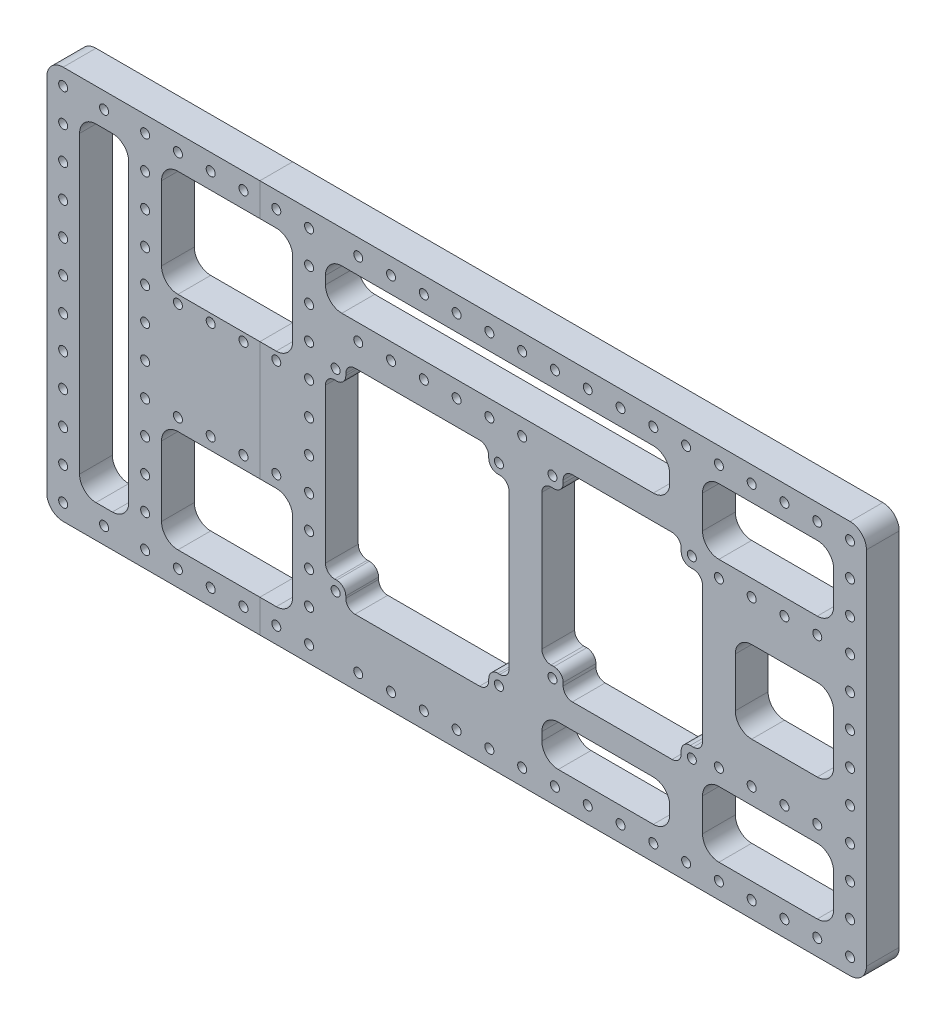
from build123d import *

# Parameters (mm, degrees)
CROQUIS1_W               = 250
CROQUIS1_H               = 120
SALIENTE_EXTRUIR1_DEPTH  = 10
CROQUIS2_W               = 15
CROQUIS2_H               = 100
CROQUIS2_W_2             = 40
CROQUIS2_W_3             = 56
CROQUIS2_H_2             = 12.5
CROQUIS2_H_3             = 65
CROQUIS2_W_4             = 50
CROQUIS2_H_4             = 70
CORTAR_EXTRUIR1_DEPTH    = 278.48873851
CROQUIS6_W               = 40
CROQUIS6_H               = 12.5
SALIENTE_EXTRUIR3_DEPTH  = 10
CROQUIS7_W               = 50
CROQUIS7_H               = 5
SALIENTE_EXTRUIR4_DEPTH  = 10
CROQUIS8_W               = 50
CROQUIS8_H               = 5
SALIENTE_EXTRUIR5_DEPTH  = 10
CROQUIS10_W              = 1
CROQUIS10_H              = 60
CROQUIS10_W_2            = 40
CROQUIS10_H_2            = 12.5
SALIENTE_EXTRUIR6_DEPTH  = 10
CROQUIS11_W              = 40
CROQUIS11_H              = 12.5
CORTAR_EXTRUIR3_DEPTH    = 278.48873851
CROQUIS12_W              = 40
CROQUIS12_H              = 12.5
SALIENTE_EXTRUIR7_DEPTH  = 10
CROQUIS13_W              = 40
CROQUIS13_H              = 25
SALIENTE_EXTRUIR9_DEPTH  = 10
CROQUIS14_W              = 30
CROQUIS14_H              = 60
CROQUIS14_W_2            = 39
CROQUIS14_H_2            = 12.5
CORTAR_EXTRUIR4_DEPTH    = 278.48873851
REDONDEO4_R              = 5
REDONDEO5_R              = 5
CROQUIS16_W              = 6.2
CROQUIS16_H              = 6.2
SALIENTE_EXTRUIR10_DEPTH = 10
CROQUIS17_W              = 6.5
CROQUIS17_H              = 6.5
SALIENTE_EXTRUIR12_DEPTH = 10
REDONDEO6_R              = 2.8
REDONDEO7_R              = 2.8
REDONDEO8_R              = 2.8
CROQUIS18_R              = 1.375
CORTAR_EXTRUIR5_DEPTH    = 278.48873851
CROQUIS19_W              = 30
CROQUIS19_H              = 17.5
SALIENTE_EXTRUIR13_DEPTH = 10
CROQUIS20_W              = 40
CROQUIS20_H              = 20
CORTAR_EXTRUIR7_DEPTH    = 278.48873851
REDONDEO9_R              = 5
CROQUIS21_R              = 1.375
CORTAR_EXTRUIR8_DEPTH    = 278.48873851
SALIENTE_EXTRUIR14_DEPTH = 10
CROQUIS23_W              = 40
CROQUIS23_H              = 25
CORTAR_EXTRUIR9_DEPTH    = 278.48873851
REDONDEO10_R             = 5
CROQUIS24_R              = 1.375
CORTAR_EXTRUIR10_DEPTH   = 278.48873851
CROQUIS25_R              = 1.375
CORTAR_EXTRUIR12_DEPTH   = 278.48873851
CROQUIS26_R              = 1.375
CORTAR_EXTRUIR13_DEPTH   = 278.48873851
CROQUIS29_R              = 1.375
CORTAR_EXTRUIR14_DEPTH   = 10
CROQUIS30_R              = 1.375
CORTAR_EXTRUIR15_DEPTH   = 278.48873851
CROQUIS35_W              = 187.46861443
CROQUIS35_H              = 5.495329455
CROQUIS35_W_2            = 76.300083138
CROQUIS35_H_2            = 6.008379166
SALIENTE_EXTRUIR18_DEPTH = 10
CROQUIS36_R              = 1.375
CORTAR_EXTRUIR16_DEPTH   = 278.48873851
CROQUIS37_W              = 100.140968042
CROQUIS37_H              = 4.413926966
SALIENTE_EXTRUIR19_DEPTH = 10
CROQUIS39_R              = 1.375
CORTAR_EXTRUIR17_DEPTH   = 10
CROQUIS40_R              = 1.375
CORTAR_EXTRUIR18_DEPTH   = 278.48873851
PARTIR1_SURFACE_1_BACK   = 278.489
PARTIR1_SURFACE_1_DEPTH  = 556.978
PARTIR1_SURFACE_2_BACK   = 278.489
PARTIR1_SURFACE_2_DEPTH  = 556.978


with BuildPart() as part:
    # Croquis1 → Saliente-Extruir1 (new body)
    with BuildSketch(Plane.XY):
        with Locations((125, 60)):
            Rectangle(CROQUIS1_W, CROQUIS1_H)
    extrude(amount=SALIENTE_EXTRUIR1_DEPTH)

    # Croquis2 → Cortar-Extruir1 (cut, through all)
    with BuildSketch(Plane.XY.offset(10)):
        with Locations((17.5, 60)):
            Rectangle(CROQUIS2_W, CROQUIS2_H)
        with Locations((55, 60)):
            Rectangle(CROQUIS2_W_2, CROQUIS2_H)
        with Locations((113, 103.75)):
            Rectangle(CROQUIS2_W_3, CROQUIS2_H_2)
        with Locations((113, 52.5)):
            Rectangle(CROQUIS2_W_3, CROQUIS2_H_3)
        with Locations((176, 60)):
            Rectangle(CROQUIS2_W_4, CROQUIS2_H_4)
    extrude(amount=-CORTAR_EXTRUIR1_DEPTH, mode=Mode.SUBTRACT)

    # Croquis6 → Saliente-Extruir3 (add)
    with BuildSketch(Plane.XY.offset(10)):
        with Locations((55, 91.25)):
            Rectangle(CROQUIS6_W, CROQUIS6_H)
    extrude(amount=-SALIENTE_EXTRUIR3_DEPTH)

    # Croquis7 → Saliente-Extruir4 (add)
    with BuildSketch(Plane.XY.offset(10)):
        with Locations((176, 27.5)):
            Rectangle(CROQUIS7_W, CROQUIS7_H)
    extrude(amount=-SALIENTE_EXTRUIR4_DEPTH)

    # Croquis8 → Saliente-Extruir5 (add)
    with BuildSketch(Plane.XY.offset(10)):
        with Locations((176, 92.5)):
            Rectangle(CROQUIS8_W, CROQUIS8_H)
    extrude(amount=-SALIENTE_EXTRUIR5_DEPTH)

    # Croquis10 → Saliente-Extruir6 (add)
    with BuildSketch(Plane.XY.offset(10)):
        with Locations((200.5, 60)):
            Rectangle(CROQUIS10_W, CROQUIS10_H)
        with Locations((220, 103.75)):
            Rectangle(CROQUIS10_W_2, CROQUIS10_H_2)
    extrude(amount=-SALIENTE_EXTRUIR6_DEPTH)

    # Croquis11 → Cortar-Extruir3 (cut, through all)
    with BuildSketch(Plane.XY.offset(10)):
        with Locations((220, 103.75)):
            Rectangle(CROQUIS11_W, CROQUIS11_H)
        with Locations((220, 16.25)):
            Rectangle(CROQUIS11_W, CROQUIS11_H)
    extrude(amount=-CORTAR_EXTRUIR3_DEPTH, mode=Mode.SUBTRACT)

    # Croquis12 → Saliente-Extruir7 (add)
    with BuildSketch(Plane.XY.offset(10)):
        with Locations((55, 78.75)):
            Rectangle(CROQUIS12_W, CROQUIS12_H)
    extrude(amount=-SALIENTE_EXTRUIR7_DEPTH)

    # Croquis13 → Saliente-Extruir9 (add)
    with BuildSketch(Plane.XY.offset(10)):
        with Locations((55, 35)):
            Rectangle(CROQUIS13_W, CROQUIS13_H)
    extrude(amount=-SALIENTE_EXTRUIR9_DEPTH)

    # Croquis14 → Cortar-Extruir4 (cut, through all)
    with BuildSketch(Plane.XY.offset(10)):
        Polygon((151, 110), (141, 110), (141, 97.5), (151, 97.5), (190, 97.5), (190, 110), align=None)
        with Locations((225, 60)):
            Rectangle(CROQUIS14_W, CROQUIS14_H)
        with Locations((170.5, 16.25)):
            Rectangle(CROQUIS14_W_2, CROQUIS14_H_2)
    extrude(amount=-CORTAR_EXTRUIR4_DEPTH, mode=Mode.SUBTRACT)

    # Redondeo4
    redondeo4_edges = [part.edges().sort_by_distance(p)[0] for p in [
        (10, 110, 5),
        (35, 72.5, 5),
        (85, 97.5, 5),
        (35, 110, 5),
        (85, 110, 5),
        (200, 22.5, 5),
        (210, 90, 5),
        (200, 110, 5),
        (210, 30, 5),
        (240, 30, 5),
        (240, 10, 5),
        (240, 97.5, 5),
        (190, 10, 5),
        (190, 97.5, 5),
        (25, 10, 5),
        (75, 97.5, 5),
        (75, 47.5, 5),
        (75, 10, 5),
        (10, 10, 5),
        (35, 97.5, 5),
        (35, 47.5, 5),
        (35, 10, 5),
        (151, 10, 5),
        (200, 10, 5),
        (200, 97.5, 5),
        (190, 22.5, 5),
        (240, 22.5, 5),
        (240, 90, 5),
        (240, 110, 5),
        (190, 110, 5),
        (75, 22.5, 5),
        (75, 72.5, 5),
        (75, 110, 5),
        (25, 110, 5),
        (0, 120, 5),
        (0, 0, 5),
        (250, 0, 5),
        (250, 120, 5),
    ]]
    fillet(redondeo4_edges, radius=REDONDEO4_R)

    # Redondeo5
    redondeo5_edges = [part.edges().sort_by_distance(p)[0] for p in [
        (35, 22.5, 5),
        (151, 22.5, 5),
    ]]
    fillet(redondeo5_edges, radius=REDONDEO5_R)

    # Croquis16 → Saliente-Extruir10 (add)
    with BuildSketch(Plane.XY.offset(10)):
        with Locations((88.1, 23.1)):
            Rectangle(CROQUIS16_W, CROQUIS16_H)
        with Locations((137.9, 23.1)):
            Rectangle(CROQUIS16_W, CROQUIS16_H)
        with Locations((137.9, 81.9)):
            Rectangle(CROQUIS16_W, CROQUIS16_H)
        with Locations((88.1, 81.9)):
            Rectangle(CROQUIS16_W, CROQUIS16_H)
    extrude(amount=-SALIENTE_EXTRUIR10_DEPTH)

    # Croquis17 → Saliente-Extruir12 (add)
    with BuildSketch(Plane.XY.offset(10)):
        with Locations((154.25, 86.75)):
            Rectangle(CROQUIS17_W, CROQUIS17_H)
        with Locations((154.25, 33.25)):
            Rectangle(CROQUIS17_W, CROQUIS17_H)
        with Locations((196.75, 86.75)):
            Rectangle(CROQUIS17_W, CROQUIS17_H)
        with Locations((196.75, 33.25)):
            Rectangle(CROQUIS17_W, CROQUIS17_H)
    extrude(amount=-SALIENTE_EXTRUIR12_DEPTH)

    # Redondeo6
    redondeo6_edges = [part.edges().sort_by_distance(p)[0] for p in [
        (157.5, 83.5, 5),
        (157.5, 36.5, 5),
        (193.5, 36.5, 5),
        (193.5, 83.5, 5),
        (134.8, 26.2, 5),
        (134.8, 78.8, 5),
        (91.2, 26.2, 5),
        (91.2, 78.8, 5),
    ]]
    fillet(redondeo6_edges, radius=REDONDEO6_R)

    # Redondeo7
    redondeo7_edges = [part.edges().sort_by_distance(p)[0] for p in [
        (193.5, 30, 5),
        (200, 36.5, 5),
        (200, 83.5, 5),
        (193.5, 90, 5),
        (134.8, 85, 5),
        (141, 78.8, 5),
        (141, 26.2, 5),
        (134.8, 20, 5),
        (157.5, 30, 5),
        (151, 36.5, 5),
        (91.2, 20, 5),
        (85, 26.2, 5),
        (85, 78.8, 5),
        (91.2, 85, 5),
    ]]
    fillet(redondeo7_edges, radius=REDONDEO7_R)

    # Redondeo8
    redondeo8_edges = [part.edges().sort_by_distance(p)[0] for p in [
        (151, 83.5, 5),
        (157.5, 90, 5),
    ]]
    fillet(redondeo8_edges, radius=REDONDEO8_R)

    # Croquis18 → Cortar-Extruir5 (cut, through all)
    with BuildSketch(Plane.XY.offset(10)):
        with Locations((137.9, 23.1)):
            Circle(CROQUIS18_R)
        with Locations((88.1, 23.1)):
            Circle(CROQUIS18_R)
        with Locations((88.1, 81.9)):
            Circle(CROQUIS18_R)
        with Locations((137.9, 81.9)):
            Circle(CROQUIS18_R)
        with Locations((154.25, 33.25)):
            Circle(CROQUIS18_R)
        with Locations((196.75, 33.25)):
            Circle(CROQUIS18_R)
        with Locations((196.75, 86.75)):
            Circle(CROQUIS18_R)
        with Locations((154.25, 86.75)):
            Circle(CROQUIS18_R)
    extrude(amount=-CORTAR_EXTRUIR5_DEPTH, mode=Mode.SUBTRACT)

    # Croquis19 → Saliente-Extruir13 (add)
    with BuildSketch(Plane.XY.offset(10)):
        with Locations((225, 81.25)):
            Rectangle(CROQUIS19_W, CROQUIS19_H)
        with Locations((225, 38.75)):
            Rectangle(CROQUIS19_W, CROQUIS19_H)
    extrude(amount=-SALIENTE_EXTRUIR13_DEPTH)

    # Croquis20 → Cortar-Extruir7 (cut, through all)
    with BuildSketch(Plane.XY.offset(10)):
        with Locations((220, 20)):
            Rectangle(CROQUIS20_W, CROQUIS20_H)
        with Locations((220, 100)):
            Rectangle(CROQUIS20_W, CROQUIS20_H)
    extrude(amount=-CORTAR_EXTRUIR7_DEPTH, mode=Mode.SUBTRACT)

    # Redondeo9
    redondeo9_edges = [part.edges().sort_by_distance(p)[0] for p in [
        (200, 10, 5),
        (210, 47.5, 5),
        (200, 90, 5),
        (240, 10, 5),
        (240, 47.5, 5),
        (240, 90, 5),
        (240, 30, 5),
        (240, 72.5, 5),
        (240, 110, 5),
        (200, 30, 5),
        (200, 110, 5),
        (210, 72.5, 5),
    ]]
    fillet(redondeo9_edges, radius=REDONDEO9_R)

    # Croquis21 → Cortar-Extruir8 (cut, through all)
    with BuildSketch(Plane.XY.offset(10)):
        with Locations((5, 115)):
            Circle(CROQUIS21_R)
        with Locations((5, 105)):
            Circle(CROQUIS21_R)
        with Locations((5, 95)):
            Circle(CROQUIS21_R)
        with Locations((5, 85)):
            Circle(CROQUIS21_R)
        with Locations((5, 75)):
            Circle(CROQUIS21_R)
        with Locations((5, 65)):
            Circle(CROQUIS21_R)
        with Locations((5, 55)):
            Circle(CROQUIS21_R)
        with Locations((5, 45)):
            Circle(CROQUIS21_R)
        with Locations((5, 35)):
            Circle(CROQUIS21_R)
        with Locations((5, 25)):
            Circle(CROQUIS21_R)
        with Locations((5, 15)):
            Circle(CROQUIS21_R)
        with Locations((5, 5)):
            Circle(CROQUIS21_R)
        with Locations((245, 5)):
            Circle(CROQUIS21_R)
        with Locations((245, 15)):
            Circle(CROQUIS21_R)
        with Locations((245, 25)):
            Circle(CROQUIS21_R)
        with Locations((245, 35)):
            Circle(CROQUIS21_R)
        with Locations((245, 45)):
            Circle(CROQUIS21_R)
        with Locations((245, 55)):
            Circle(CROQUIS21_R)
        with Locations((245, 65)):
            Circle(CROQUIS21_R)
        with Locations((245, 75)):
            Circle(CROQUIS21_R)
        with Locations((245, 85)):
            Circle(CROQUIS21_R)
        with Locations((245, 95)):
            Circle(CROQUIS21_R)
        with Locations((245, 105)):
            Circle(CROQUIS21_R)
        with Locations((245, 115)):
            Circle(CROQUIS21_R)
        with Locations((15, 115)):
            Circle(CROQUIS21_R)
        with Locations((25, 115)):
            Circle(CROQUIS21_R)
        with Locations((35, 115)):
            Circle(CROQUIS21_R)
        with Locations((45, 115)):
            Circle(CROQUIS21_R)
        with Locations((55, 115)):
            Circle(CROQUIS21_R)
        with Locations((65, 115)):
            Circle(CROQUIS21_R)
        with Locations((75, 115)):
            Circle(CROQUIS21_R)
        with Locations((85, 115)):
            Circle(CROQUIS21_R)
        with Locations((95, 115)):
            Circle(CROQUIS21_R)
        with Locations((105, 115)):
            Circle(CROQUIS21_R)
        with Locations((115, 115)):
            Circle(CROQUIS21_R)
        with Locations((125, 115)):
            Circle(CROQUIS21_R)
        with Locations((135, 115)):
            Circle(CROQUIS21_R)
        with Locations((145, 115)):
            Circle(CROQUIS21_R)
        with Locations((155, 115)):
            Circle(CROQUIS21_R)
        with Locations((165, 115)):
            Circle(CROQUIS21_R)
        with Locations((175, 115)):
            Circle(CROQUIS21_R)
        with Locations((185, 115)):
            Circle(CROQUIS21_R)
        with Locations((195, 115)):
            Circle(CROQUIS21_R)
        with Locations((205, 115)):
            Circle(CROQUIS21_R)
        with Locations((215, 115)):
            Circle(CROQUIS21_R)
        with Locations((225, 115)):
            Circle(CROQUIS21_R)
        with Locations((235, 115)):
            Circle(CROQUIS21_R)
        with Locations((235, 5)):
            Circle(CROQUIS21_R)
        with Locations((225, 5)):
            Circle(CROQUIS21_R)
        with Locations((215, 5)):
            Circle(CROQUIS21_R)
        with Locations((205, 5)):
            Circle(CROQUIS21_R)
        with Locations((195, 5)):
            Circle(CROQUIS21_R)
        with Locations((185, 5)):
            Circle(CROQUIS21_R)
        with Locations((175, 5)):
            Circle(CROQUIS21_R)
        with Locations((165, 5)):
            Circle(CROQUIS21_R)
        with Locations((155, 5)):
            Circle(CROQUIS21_R)
        with Locations((145, 5)):
            Circle(CROQUIS21_R)
        with Locations((135, 5)):
            Circle(CROQUIS21_R)
        with Locations((125, 5)):
            Circle(CROQUIS21_R)
        with Locations((115, 5)):
            Circle(CROQUIS21_R)
        with Locations((105, 5)):
            Circle(CROQUIS21_R)
        with Locations((95, 5)):
            Circle(CROQUIS21_R)
        with Locations((85, 5)):
            Circle(CROQUIS21_R)
        with Locations((75, 5)):
            Circle(CROQUIS21_R)
        with Locations((65, 5)):
            Circle(CROQUIS21_R)
        with Locations((55, 5)):
            Circle(CROQUIS21_R)
        with Locations((45, 5)):
            Circle(CROQUIS21_R)
        with Locations((35, 5)):
            Circle(CROQUIS21_R)
        with Locations((25, 5)):
            Circle(CROQUIS21_R)
        with Locations((15, 5)):
            Circle(CROQUIS21_R)
    extrude(amount=-CORTAR_EXTRUIR8_DEPTH, mode=Mode.SUBTRACT)

    # Croquis22 → Saliente-Extruir14 (add)
    with BuildSketch(Plane.XY.offset(10)):
        Polygon((35, 16.25), (75, 16.25), (75, 38.248408684), (75, 102.5), (35, 102.5), align=None)
    extrude(amount=-SALIENTE_EXTRUIR14_DEPTH)

    # Croquis23 → Cortar-Extruir9 (cut, through all)
    with BuildSketch(Plane.XY.offset(10)):
        with Locations((55, 28.75)):
            Rectangle(CROQUIS23_W, CROQUIS23_H)
        with Locations((55, 90)):
            Rectangle(CROQUIS23_W, CROQUIS23_H)
    extrude(amount=-CORTAR_EXTRUIR9_DEPTH, mode=Mode.SUBTRACT)

    # Redondeo10
    redondeo10_edges = [part.edges().sort_by_distance(p)[0] for p in [
        (35, 77.5, 5),
        (75, 77.5, 5),
        (75, 41.25, 5),
        (35, 41.25, 5),
    ]]
    fillet(redondeo10_edges, radius=REDONDEO10_R)

    # Croquis24 → Cortar-Extruir10 (cut, through all)
    with BuildSketch(Plane.XY.offset(10)):
        with Locations((30, 105)):
            Circle(CROQUIS24_R)
        with Locations((30, 95)):
            Circle(CROQUIS24_R)
        with Locations((30, 85)):
            Circle(CROQUIS24_R)
        with Locations((30, 75)):
            Circle(CROQUIS24_R)
        with Locations((30, 65)):
            Circle(CROQUIS24_R)
        with Locations((30, 55)):
            Circle(CROQUIS24_R)
        with Locations((30, 45)):
            Circle(CROQUIS24_R)
        with Locations((30, 35)):
            Circle(CROQUIS24_R)
        with Locations((30, 25)):
            Circle(CROQUIS24_R)
        with Locations((30, 15)):
            Circle(CROQUIS24_R)
    extrude(amount=-CORTAR_EXTRUIR10_DEPTH, mode=Mode.SUBTRACT)

    # Croquis25 → Cortar-Extruir12 (cut, through all)
    with BuildSketch(Plane.XY.offset(10)):
        with Locations((80, 75)):
            Circle(CROQUIS25_R)
        with Locations((80, 65)):
            Circle(CROQUIS25_R)
        with Locations((80, 55)):
            Circle(CROQUIS25_R)
        with Locations((80, 45)):
            Circle(CROQUIS25_R)
        with Locations((80, 85)):
            Circle(CROQUIS25_R)
        with Locations((80, 95)):
            Circle(CROQUIS25_R)
        with Locations((80, 105)):
            Circle(CROQUIS25_R)
        with Locations((80, 35)):
            Circle(CROQUIS25_R)
        with Locations((80, 25)):
            Circle(CROQUIS25_R)
        with Locations((80, 15)):
            Circle(CROQUIS25_R)
    extrude(amount=-CORTAR_EXTRUIR12_DEPTH, mode=Mode.SUBTRACT)

    # Croquis26 → Cortar-Extruir13 (cut, through all)
    with BuildSketch(Plane.XY.offset(10)):
        with Locations((183.625, 93.642893295)):
            Circle(CROQUIS26_R)
        with Locations((173.625, 93.642893295)):
            Circle(CROQUIS26_R)
        with Locations((163.625, 93.642893295)):
            Circle(CROQUIS26_R)
        with Locations((153.625, 93.642893295)):
            Circle(CROQUIS26_R)
        with Locations((143.625, 93.642893295)):
            Circle(CROQUIS26_R)
        with Locations((133.625, 93.642893295)):
            Circle(CROQUIS26_R)
        with Locations((123.625, 93.642893295)):
            Circle(CROQUIS26_R)
        with Locations((113.625, 93.642893295)):
            Circle(CROQUIS26_R)
        with Locations((103.625, 93.642893295)):
            Circle(CROQUIS26_R)
        with Locations((93.625, 93.642893295)):
            Circle(CROQUIS26_R)
    extrude(amount=-CORTAR_EXTRUIR13_DEPTH, mode=Mode.SUBTRACT)

    # Croquis29 → Cortar-Extruir14 (cut)
    with BuildSketch(Plane.XY.offset(10)):
        with Locations((70, 75)):
            Circle(CROQUIS29_R)
        with Locations((40, 45)):
            Circle(CROQUIS29_R)
        with Locations((50, 45)):
            Circle(CROQUIS29_R)
        with Locations((60, 45)):
            Circle(CROQUIS29_R)
        with Locations((70, 45)):
            Circle(CROQUIS29_R)
        with Locations((60, 75)):
            Circle(CROQUIS29_R)
        with Locations((50, 75)):
            Circle(CROQUIS29_R)
        with Locations((40, 75)):
            Circle(CROQUIS29_R)
    extrude(amount=-CORTAR_EXTRUIR14_DEPTH, mode=Mode.SUBTRACT)

    # Croquis30 → Cortar-Extruir15 (cut, through all)
    with BuildSketch(Plane.XY.offset(10)):
        with Locations((205, 35)):
            Circle(CROQUIS30_R)
        with Locations((235, 85)):
            Circle(CROQUIS30_R)
        with Locations((225, 85)):
            Circle(CROQUIS30_R)
        with Locations((215, 85)):
            Circle(CROQUIS30_R)
        with Locations((205, 85)):
            Circle(CROQUIS30_R)
        with Locations((215, 35)):
            Circle(CROQUIS30_R)
        with Locations((225, 35)):
            Circle(CROQUIS30_R)
        with Locations((235, 35)):
            Circle(CROQUIS30_R)
    extrude(amount=-CORTAR_EXTRUIR15_DEPTH, mode=Mode.SUBTRACT)

    # Croquis35 → Saliente-Extruir18 (add)
    with BuildSketch(Plane.XY.offset(10)):
        with Locations((105.08724009, 5.030826662)):
            Rectangle(CROQUIS35_W, CROQUIS35_H)
        with Locations((49.502974444, 115.098732518)):
            Rectangle(CROQUIS35_W_2, CROQUIS35_H_2)
    extrude(amount=-SALIENTE_EXTRUIR18_DEPTH)

    # Croquis36 → Cortar-Extruir16 (cut, through all)
    with BuildSketch(Plane.XY.offset(10)):
        with Locations((70, 115)):
            Circle(CROQUIS36_R)
        with Locations((60, 115)):
            Circle(CROQUIS36_R)
        with Locations((50, 115)):
            Circle(CROQUIS36_R)
        with Locations((40, 115)):
            Circle(CROQUIS36_R)
        with Locations((30, 115)):
            Circle(CROQUIS36_R)
        with Locations((80, 115)):
            Circle(CROQUIS36_R)
        with Locations((80, 5)):
            Circle(CROQUIS36_R)
        with Locations((30, 5)):
            Circle(CROQUIS36_R)
        with Locations((40, 5)):
            Circle(CROQUIS36_R)
        with Locations((50, 5)):
            Circle(CROQUIS36_R)
        with Locations((60, 5)):
            Circle(CROQUIS36_R)
        with Locations((70, 5)):
            Circle(CROQUIS36_R)
        with Locations((17.483957542, 5.066778622)):
            Circle(CROQUIS36_R)
        with Locations((17.481285828, 115.028562194)):
            Circle(CROQUIS36_R)
    extrude(amount=-CORTAR_EXTRUIR16_DEPTH, mode=Mode.SUBTRACT)

    # Croquis37 → Saliente-Extruir19 (add)
    with BuildSketch(Plane.XY.offset(10)):
        with Locations((137.448580314, 93.959275173)):
            Rectangle(CROQUIS37_W, CROQUIS37_H)
    extrude(amount=-SALIENTE_EXTRUIR19_DEPTH)

    # Croquis39 → Cortar-Extruir17 (cut)
    with BuildSketch(Plane.XY.offset(10)):
        with Locations((105, 92.5)):
            Circle(CROQUIS39_R)
        with Locations((95, 92.5)):
            Circle(CROQUIS39_R)
        with Locations((115, 92.5)):
            Circle(CROQUIS39_R)
        with Locations((125, 92.5)):
            Circle(CROQUIS39_R)
        with Locations((135, 92.5)):
            Circle(CROQUIS39_R)
        with Locations((145, 92.5)):
            Circle(CROQUIS39_R)
    extrude(amount=-CORTAR_EXTRUIR17_DEPTH, mode=Mode.SUBTRACT)

    # Croquis40 → Cortar-Extruir18 (cut, through all)
    with BuildSketch(Plane.XY.offset(10)):
        with Locations((95, 5)):
            Circle(CROQUIS40_R)
        with Locations((105, 5)):
            Circle(CROQUIS40_R)
        with Locations((115, 5)):
            Circle(CROQUIS40_R)
        with Locations((125, 5)):
            Circle(CROQUIS40_R)
        with Locations((135, 5)):
            Circle(CROQUIS40_R)
        with Locations((145, 5)):
            Circle(CROQUIS40_R)
        with Locations((155, 5)):
            Circle(CROQUIS40_R)
        with Locations((165, 5)):
            Circle(CROQUIS40_R)
        with Locations((175, 5)):
            Circle(CROQUIS40_R)
        with Locations((185, 5)):
            Circle(CROQUIS40_R)
        with Locations((195, 5)):
            Circle(CROQUIS40_R)
    extrude(amount=-CORTAR_EXTRUIR18_DEPTH, mode=Mode.SUBTRACT)


with BuildPart() as body_2:
    # Partir1: the piece behind the surface
    add(part.part)
    # Partir1 surface: a surface, the sketch's curves swept straight by 556.978 mm
    with BuildLine(Plane.XY.offset(10).offset(-PARTIR1_SURFACE_1_BACK), mode=Mode.PRIVATE) as partir1_surface_1_path:
        Line((65, 0), (65, 120))
    partir1_surface_1 = Shell.extrude(partir1_surface_1_path.wire(), (0 * PARTIR1_SURFACE_1_DEPTH, 0 * PARTIR1_SURFACE_1_DEPTH, 1 * PARTIR1_SURFACE_1_DEPTH))
    split(bisect_by=partir1_surface_1, keep=Keep.BOTTOM)


with BuildPart() as part_1:
    add(part.part)

    # Partir1: split by a surface, the side it looks to stays
    # Partir1 surface: a surface, the sketch's curves swept straight by 556.978 mm
    with BuildLine(Plane.XY.offset(10).offset(-PARTIR1_SURFACE_2_BACK), mode=Mode.PRIVATE) as partir1_surface_2_path:
        Line((65, 0), (65, 120))
    partir1_surface_2 = Shell.extrude(partir1_surface_2_path.wire(), (0 * PARTIR1_SURFACE_2_DEPTH, 0 * PARTIR1_SURFACE_2_DEPTH, 1 * PARTIR1_SURFACE_2_DEPTH))
    split(bisect_by=partir1_surface_2, keep=Keep.TOP)


solid = Compound([body_2.part, part_1.part])
